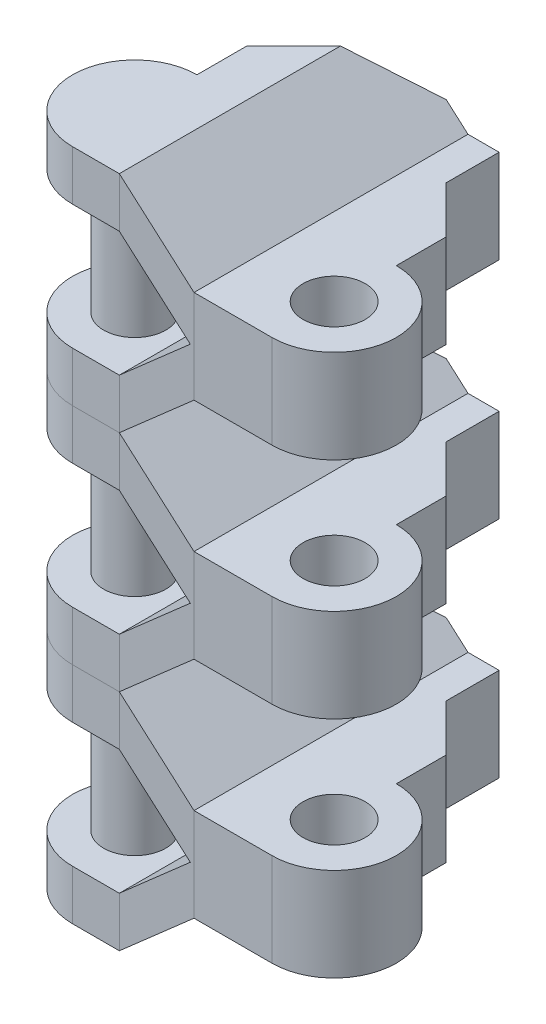
from build123d import *

# Parameters (mm, degrees)
SWEEP1_START            = -3.9624
SWEEP1_DEPTH            = 7.9248
FILLET1_R               = 3.9624
BOSS_EXTRUDE3_START     = 17.25625
SKETCH1_11_R            = 3.9624
BOSS_EXTRUDE3_DEPTH     = 5.937499936
CUT_EXTRUDE4_DEPTH      = 25.111090479
CUT_EXTRUDE4_DEPTH_BACK = 25.111090479
SKETCH1_7_R             = 1.9812
BOSS_EXTRUDE1_START     = 21.43125
SKETCH1_R               = 1.9812
BOSS_EXTRUDE1_DEPTH     = 14.2875
BOSS_EXTRUDE5_START     = 21.43125
SKETCH5_W               = 12.7
SKETCH5_H               = 0.500000016
SKETCH5_H_2             = 3.175
BOSS_EXTRUDE5_DEPTH     = 14.2875
CUT_EXTRUDE5_DEPTH      = 28.341434291
LPATTERN4_COUNT         = 3
LPATTERN4_PITCH         = 14.2875


# Read off the part's stored shape, not the designer's step: Sweep1
with BuildPart() as part:
    # Sweep1 outline → Sweep1 (new body)
    with BuildSketch(Plane.XY.offset(SWEEP1_START)):
        Polygon((1.387599968, 14.081249968), (10.3124, 14.081249968), (10.3124, 17.256249968), (1.387599968, 17.256249968), (-3.368799968, 21.43125), (-10.3124, 21.43125), (-10.3124, 18.25625), (-3.368799968, 18.25625), align=None)
    extrude(amount=SWEEP1_DEPTH)

    # Fillet1
    fillet1_edges = [part.edges().sort_by_distance(p)[0] for p in [
        (-10.3124, 19.84375, 3.9624),
        (-10.3124, 19.84375, -3.9624),
        (10.3124, 15.668749968, -3.9624),
        (10.3124, 15.668749968, 3.9624),
    ]]
    fillet(fillet1_edges, radius=FILLET1_R - 0.0001)  # a hair under: the kernel refuses the full size

    # Mirror3: part across plane


with BuildPart() as part_1:
    add(part.part)
    add(part.part.mirror(Plane.ZX.offset(14.2875)))

    # Sketch1<11> → Boss-Extrude3 (add)
    with BuildSketch(Plane(origin=(0, 0, 0), x_dir=(-1, 0, 0), z_dir=(0, 1, 0)).offset(BOSS_EXTRUDE3_START)):
        with Locations((-6.35, 0)):
            Circle(SKETCH1_11_R)
    extrude(amount=-BOSS_EXTRUDE3_DEPTH)

    # Sketch1<7> → Cut-Extrude4 (cut, two sides: drawn at the far end of the back side and taken through both)
    with BuildSketch(Plane(origin=(0, 0, 0), x_dir=(-1, 0, 0), z_dir=(0, 1, 0)).offset(-CUT_EXTRUDE4_DEPTH_BACK)):
        with Locations(Location((-6.35, 0, 0), (0, 0, 270))):
            Circle(SKETCH1_7_R)
    extrude(amount=CUT_EXTRUDE4_DEPTH + CUT_EXTRUDE4_DEPTH_BACK, mode=Mode.SUBTRACT)

    # Sketch1 → Boss-Extrude1 (add)
    with BuildSketch(Plane(origin=(0, 0, 0), x_dir=(-1, 0, 0), z_dir=(0, 1, 0)).offset(BOSS_EXTRUDE1_START)):
        with Locations((6.35, 0)):
            Circle(SKETCH1_R)
    extrude(amount=-BOSS_EXTRUDE1_DEPTH)

    # Sketch5 → Boss-Extrude5 (add)
    with BuildSketch(Plane(origin=(0, 0, 0), x_dir=(-1, 0, 0), z_dir=(0, 1, 0)).offset(BOSS_EXTRUDE5_START)):
        with Locations((0, -3.712399992)):
            Rectangle(SKETCH5_W, SKETCH5_H)
        with Locations((0, -5.5499)):
            Rectangle(SKETCH5_W, SKETCH5_H_2)
        Polygon((6.35, -7.1374), (-6.35, -7.1374), (-3.367213597, -10.120186403), (-3.367213597, -13.4874), (0, -13.4874), align=None)
    extrude(amount=-BOSS_EXTRUDE5_DEPTH)

    # Sketch2<5> → Cut-Extrude5 (cut, symmetric)
    with BuildSketch(Plane(origin=(0, 0, 0), x_dir=(0, 1, 0), z_dir=(0, 0, 1))):
        Polygon((21.43125, 70.492676256), (21.43125, 10.3124), (21.43125, 3.368799968), (17.256249968, -1.387599968), (17.256249968, -10.3124), (17.256249968, -70.492676256), (137.564063269, -74.055352204), (141.739063301, 66.930000309), align=None)
    cut_extrude5 = extrude(amount=CUT_EXTRUDE5_DEPTH, both=True, mode=Mode.SUBTRACT)

    # Mirror7: Cut-Extrude5 across plane
    add(cut_extrude5.mirror(Plane.ZX.offset(14.2875)), mode=Mode.SUBTRACT)


with BuildPart() as lpattern4_1:
    # LPattern4: pattern copy
    add(part_1.part.moved(Location(Vector(0, -1, 0) * (1 * LPATTERN4_PITCH))))


with BuildPart() as lpattern4_2:
    # LPattern4: pattern copy
    add(part_1.part.moved(Location(Vector(0, -1, 0) * (2 * LPATTERN4_PITCH))))


solid = Compound([part_1.part, lpattern4_1.part, lpattern4_2.part])
